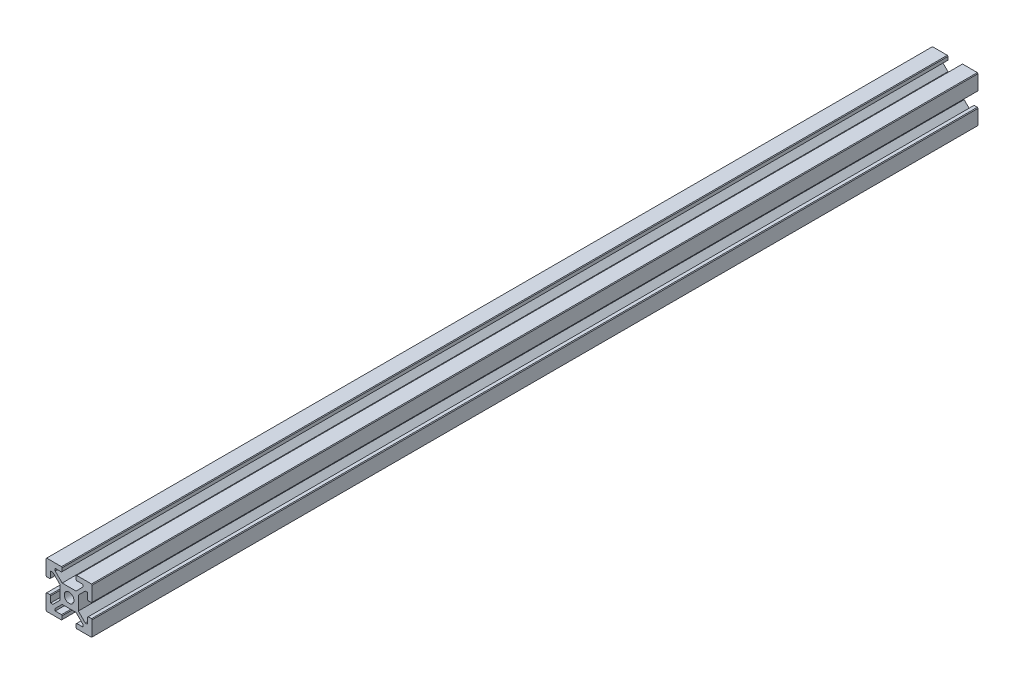
from build123d import *

# Parameters (mm, degrees)
SKETCH1_R           = 2.1
BOSS_EXTRUDE1_DEPTH = 383.54
CHAMFER1_SIZE       = 0.2828


with BuildPart() as part:
    # Sketch1 → Boss-Extrude1 (new body)
    with BuildSketch(Plane.XY):
        Polygon((-3, 8), (-3, 10), (-10, 10), (-10, 3), (-8, 3), (-8, 6), (-7, 6), (-4, 3), (-4, -3), (-7, -6), (-8, -6), (-8, -3), (-10, -3), (-10, -10), (-3, -10), (-3, -8), (-6, -8), (-6, -7), (-3, -4), (3, -4), (6, -7), (6, -8), (3, -8), (3, -10), (10, -10), (10, -3), (8, -3), (8, -6), (7, -6), (4, -3), (4, 3), (7, 6), (8, 6), (8, 3), (10, 3), (10, 10), (3, 10), (3, 8), (6, 8), (6, 7), (3, 4), (-3, 4), (-6, 7), (-6, 8), align=None)
        Circle(SKETCH1_R, mode=Mode.SUBTRACT)
    extrude(amount=BOSS_EXTRUDE1_DEPTH)

    # Chamfer1
    chamfer1_edges = [part.edges().sort_by_distance(p)[0] for p in [
        (-8, 3, 191.77),
        (-3, 8, 191.77),
        (-3, 10, 191.77),
        (-10, 3, 191.77),
        (-10, 10, 191.77),
        (-8, -3, 191.77),
        (-10, -3, 191.77),
        (-10, -10, 191.77),
        (-3, -10, 191.77),
        (-3, -8, 191.77),
        (3, -8, 191.77),
        (3, -10, 191.77),
        (8, -3, 191.77),
        (10, -10, 191.77),
        (10, -3, 191.77),
        (8, 3, 191.77),
        (10, 3, 191.77),
        (10, 10, 191.77),
        (3, 8, 191.77),
        (3, 10, 191.77),
    ]]
    chamfer(chamfer1_edges, length=CHAMFER1_SIZE)


solid = part.part
